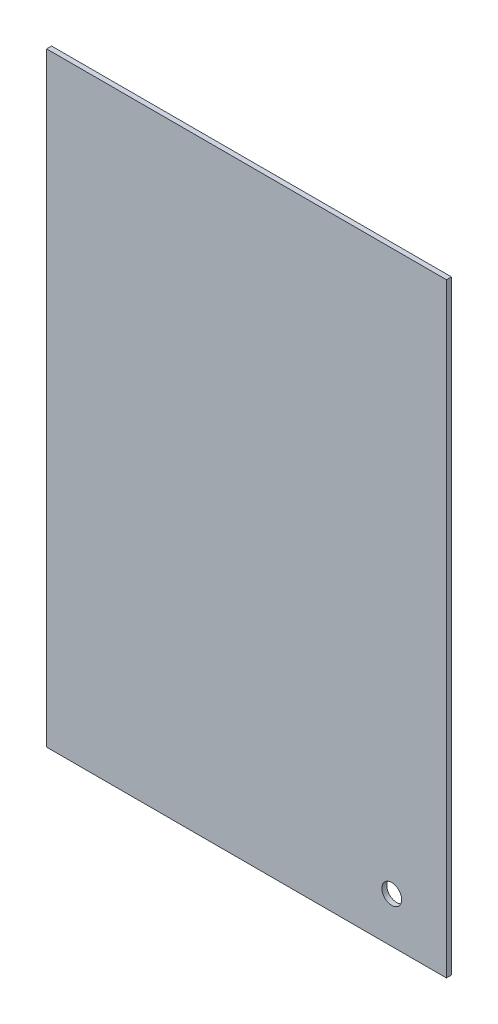
from build123d import *

# Parameters (mm, degrees)
SKETCH1_W           = 242
SKETCH1_H           = 366
BOSS_EXTRUDE1_DEPTH = 3
CUT_EXTRUDE1_REACH  = 221.406
SKETCH2_R           = 6


with BuildPart() as part:
    # Sketch1 → Boss-Extrude1 (new body)
    with BuildSketch(Plane.XY):
        Rectangle(SKETCH1_W, SKETCH1_H)
    extrude(amount=BOSS_EXTRUDE1_DEPTH)

    # Sketch2 → Cut-Extrude1 (cut, up to next)
    with BuildSketch(Plane.XY.offset(3), mode=Mode.PRIVATE) as cut_extrude1_sk1:
        with Locations((87.9, -155.5)):
            Circle(SKETCH2_R)
    cut_extrude1_tool1 = extrude(cut_extrude1_sk1.sketch, amount=-CUT_EXTRUDE1_REACH, mode=Mode.PRIVATE) & part.part
    add(cut_extrude1_tool1.solids().sort_by_distance((87.9, -155.5, 3))[0], mode=Mode.SUBTRACT)


solid = part.part
